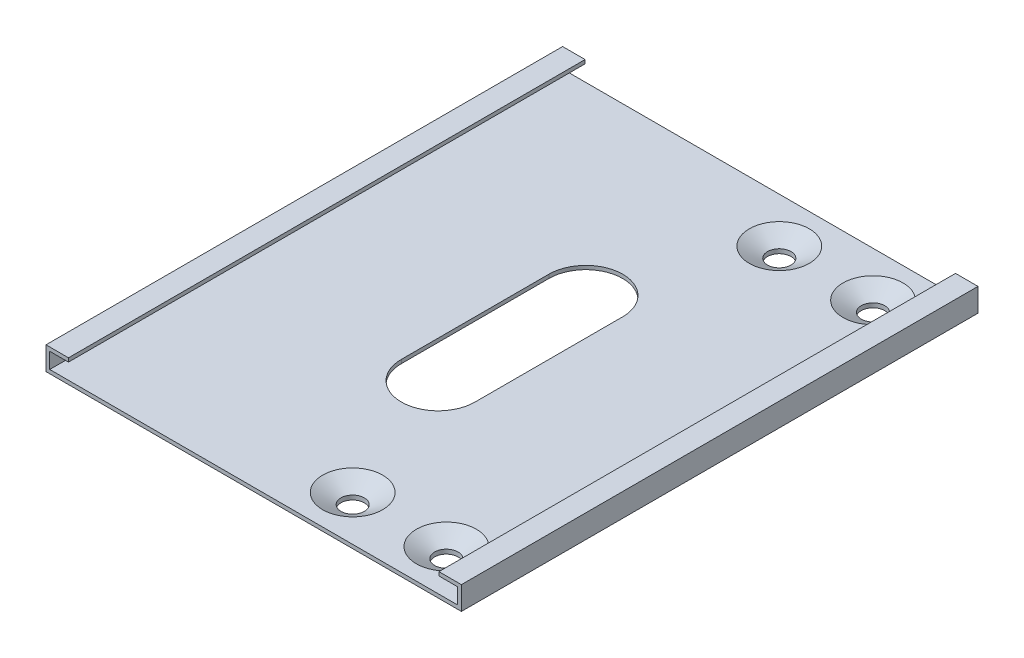
from build123d import *

# Parameters (mm, degrees)
EXTRUDE_THIN3_DEPTH     = 70
CUT_EXTRUDE1_DEPTH      = 76.511321578
CUT_EXTRUDE1_DEPTH_BACK = 76.511321578
SKETCH9_R               = 4.064
CUT_EXTRUDE2_DEPTH      = 2.54
LPATTERN1_COUNT         = 2
LPATTERN1_PITCH         = 12.7


# Read off the part's stored shape, not the designer's step: Mirror1
with BuildPart() as part:
    # Sketch6 → Extrude-Thin3 (new body)
    with BuildSketch(Plane.XY):
        Polygon((25.0952, 2.1336), (27.6352, 2.1336), (27.6352, 0), (-27.6352, 0), (-27.6352, 2.1336), (-25.0952, 2.1336), (-25.0952, 2.6416), (-28.1432, 2.6416), (-28.1432, -0.508), (28.1432, -0.508), (28.1432, 2.6416), (25.0952, 2.6416), align=None)
    extrude(amount=EXTRUDE_THIN3_DEPTH)

    # Sketch8 → Cut-Extrude1 (cut, two sides: drawn at the far end of the back side and taken through both)
    with BuildSketch(Plane.XZ.offset(0.508).offset(-CUT_EXTRUDE1_DEPTH_BACK)):
        with BuildLine():
            Line((5, 45), (5, 25))
            ThreePointArc((5, 25), (0, 20), (-5, 25))
            Line((-5, 25), (-5, 45))
            ThreePointArc((-5, 45), (0, 50), (5, 45))
        make_face()
    extrude(amount=CUT_EXTRUDE1_DEPTH + CUT_EXTRUDE1_DEPTH_BACK, mode=Mode.SUBTRACT)

    # Sketch9 → Cut-Extrude2 (cut)
    with BuildSketch(Plane.XZ.offset(0.508)):
        with Locations(Location((20.0152, 63.904, 0), (0, 0, 270))):
            Circle(SKETCH9_R)
    cut_extrude2 = extrude(amount=-CUT_EXTRUDE2_DEPTH, mode=Mode.SUBTRACT)

    # Sketch10 → Revolve1 (revolve)
    with BuildSketch(Plane(origin=(0, 0, 63.904), x_dir=(0, -1, 0), z_dir=(0, 0, 1)), mode=Mode.PRIVATE) as revolve1_sk:
        Polygon((0, 24.0792), (1.429807942, 21.6027), (2.016395815, 21.6027), (0, 25.0952), align=None)
    revolve1 = revolve(revolve1_sk.sketch.rotate(Axis((20.0152, 10.109887768, 63.904), (0, -1, 0)), 90), axis=Axis((20.0152, 10.109887768, 63.904), (0, -1, 0)))

    # LPattern1: Cut-Extrude2, Revolve1 ×2
    with Locations(*[(-i * LPATTERN1_PITCH, 0, 0) for i in range(1, LPATTERN1_COUNT)]):
        add(cut_extrude2, mode=Mode.SUBTRACT)
        add(revolve1)

    # Mirror1 outline → Mirror1 (revolve)
    with BuildSketch(Plane(origin=(20.0152, 0, 6.096), x_dir=(1, 0, 0), z_dir=(0, 0, 1))):
        Polygon((3.18411819, -0.508), (1.5875, -1.429807942), (1.5875, -2.016395815), (4.20011819, -0.508), align=None)
    revolve(axis=Axis((20.0152, 0, 6.096), (0, 1, 0)))

    # Mirror1 2 outline → Mirror1 2 (revolve)
    with BuildSketch(Plane(origin=(7.3152, 0, 6.096), x_dir=(1, 0, 0), z_dir=(0, 0, 1))):
        Polygon((3.18411819, -0.508), (1.5875, -1.429807942), (1.5875, -2.016395815), (4.20011819, -0.508), align=None)
    revolve(axis=Axis((7.3152, 0, 6.096), (0, 1, 0)))

    # Mirror1 3 outline → Mirror1 3 (revolve, cut)
    with BuildSketch(Plane(origin=(20.0152, 0, 6.096), x_dir=(1, 0, 0), z_dir=(0, 0, 1))):
        Polygon((3.18411819, -0.508), (4.064, 0), (0, 0), (0, -0.508), align=None)
    revolve(axis=Axis((20.0152, 0, 6.096), (0, 1, 0)), mode=Mode.SUBTRACT)

    # Mirror1 4 outline → Mirror1 4 (revolve, cut)
    with BuildSketch(Plane(origin=(7.3152, 0, 6.096), x_dir=(1, 0, 0), z_dir=(0, 0, 1))):
        Polygon((3.18411819, -0.508), (4.064, 0), (0, 0), (0, -0.508), align=None)
    revolve(axis=Axis((7.3152, 0, 6.096), (0, 1, 0)), mode=Mode.SUBTRACT)


solid = part.part
